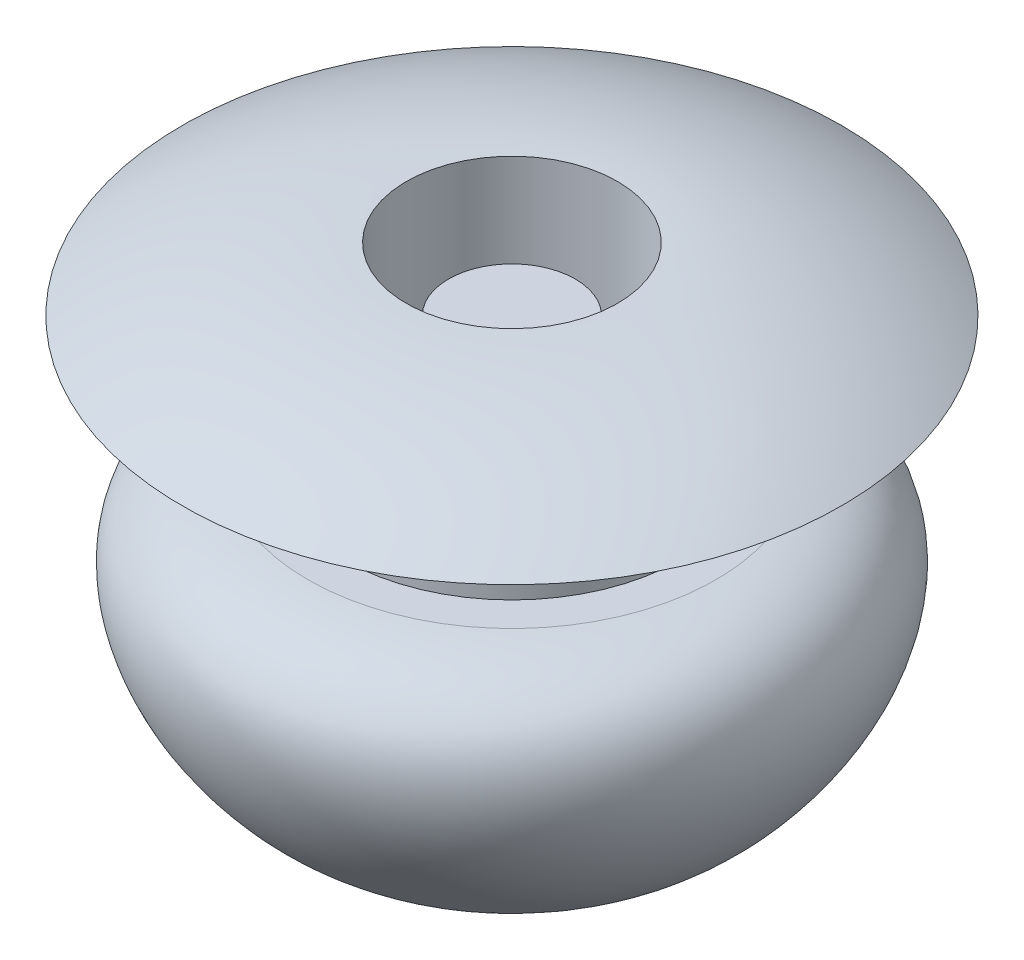
from build123d import *


with BuildPart() as part:
    # Szkic1 → Obrót1 (revolve)
    with BuildSketch(Plane(origin=(0, 0, 0), x_dir=(0, 0, -1), z_dir=(1, 0, 0))):
        with BuildLine():
            Line((0, 0), (-0.75, 0))
            Line((-0.75, 0), (-0.75, -1.700742842))
            Line((-0.75, -1.700742842), (-1.25, -1.700742842))
            Line((-1.25, -1.700742842), (-1.25, 0.75))
            ThreePointArc((-1.25, 0.75), (-2.627043935, 0.558888572), (-3.9, 0))
            Line((-3.9, 0), (-2, 0))
            Line((-2, 0), (-2, -1.500004319))
            Line((-2, -1.500004319), (-2.413891755, -1.500004319))
            add(Edge.make_bspline(
                [(-2.413891755, -1.500004319), (-3.867503112, -1.669661641), (-3.528877649, -3.802017946), (-1.083961642, -5.373536688), (-0.271752618, -3.374953617), (-0.956030427, -3.078933513)],
                knots=[0, 0, 0, 0, 0.464993082, 0.721927553, 1, 1, 1, 1], degree=3))
            add(Edge.make_bspline(
                [(-0.956030427, -3.078933513), (-0.520263876, -3.200742842), (0, -3.200742842)],
                knots=[0.992852221, 0.992852221, 0.992852221, 1.570796327, 1.570796327, 1.570796327], degree=2, weights=[1, 0.958537313, 1]))
            Line((0, -3.200742842), (0, -1.700742842))
            Line((0, -1.700742842), (0, 0))
        make_face()
    revolve(axis=Axis((0, 0, 0), (0, 1, 0)))


solid = part.part
